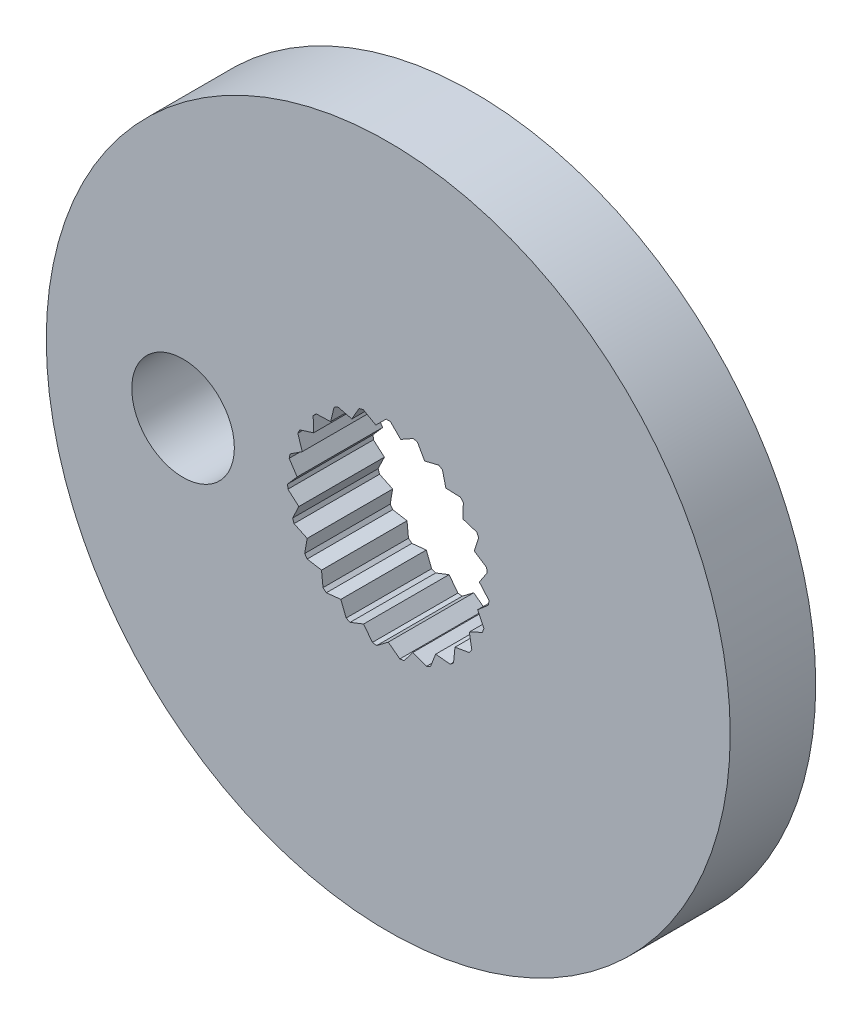
from build123d import *

# Parameters (mm, degrees)
SKETCH1_R              = 10
BOSS_EXTRUDE1_DEPTH    = 2.5
CUT_EXTRUDE1_OUTLINE_R = 1.5
CUT_EXTRUDE1_DEPTH     = 2.5


# Read off the part's stored shape, not the designer's step: Cut-Extrude1
with BuildPart() as part:
    # Sketch1 → Boss-Extrude1 (new body)
    with BuildSketch(Plane.XY):
        Circle(SKETCH1_R)
        Polygon((-2.644215925, 1.298692578), (-2.51581008, 0.894119117), (-2.870737377, 0.661322297), (-2.883640833, 0.599227456), (-2.896544289, 0.537132615), (-2.663747469, 0.182205319), (-2.942705268, -0.137717003), (-2.938377242, -0.20099051), (-2.934049215, -0.264264016), (-2.614126893, -0.543221815), (-2.796426171, -0.926542463), (-2.775187652, -0.986301929), (-2.753949133, -1.046061394), (-2.370628485, -1.228360672), (-2.442748938, -1.646650507), (-2.40617509, -1.698463845), (-2.369601242, -1.750277184), (-1.951311407, -1.822397637), (-1.907904191, -2.244634016), (-1.858707529, -2.284658469), (-1.809510867, -2.324682922), (-1.387274489, -2.281275706), (-1.231558919, -2.676143288), (-1.173388134, -2.701410425), (-1.115217349, -2.726677563), (-0.720349768, -2.570961993), (-0.463874555, -2.909175255), (-0.401043909, -2.917811129), (-0.338213262, -2.926447002), (0, -2.669971789), (0.338213262, -2.926447002), (0.401043909, -2.917811129), (0.463874555, -2.909175255), (0.720349768, -2.570961993), (1.115217349, -2.726677563), (1.173388134, -2.701410425), (1.231558919, -2.676143288), (1.387274489, -2.281275706), (1.809510867, -2.324682922), (1.858707529, -2.284658469), (1.907904191, -2.244634016), (1.951311407, -1.822397637), (2.369601242, -1.750277184), (2.40617509, -1.698463845), (2.442748938, -1.646650507), (2.370628485, -1.228360672), (2.753949133, -1.046061394), (2.775187652, -0.986301929), (2.796426171, -0.926542463), (2.614126893, -0.543221815), (2.934049215, -0.264264016), (2.938377242, -0.20099051), (2.942705268, -0.137717003), (2.663747469, 0.182205319), (2.896544289, 0.537132615), (2.883640833, 0.599227456), (2.870737377, 0.661322297), (2.51581008, 0.894119117), (2.644215925, 1.298692578), (2.615037976, 1.355003462), (2.585860027, 1.411314347), (2.181286567, 1.539720192), (2.195778161, 1.963934453), (2.152489715, 2.010285061), (2.109201269, 2.056635669), (1.684987008, 2.071127263), (1.584489576, 2.483520294), (1.530301139, 2.516473013), (1.476112702, 2.549425731), (1.063719671, 2.4489283), (0.855686648, 2.818914796), (0.794617128, 2.836025673), (0.733547608, 2.85313655), (0.363561112, 2.645103528), (0.063421356, 2.945243283), (0, 2.945243283), (-0.063421356, 2.945243283), (-0.363561112, 2.645103528), (-0.733547608, 2.85313655), (-0.794617128, 2.836025673), (-0.855686648, 2.818914796), (-1.063719671, 2.4489283), (-1.476112702, 2.549425731), (-1.530301139, 2.516473013), (-1.584489576, 2.483520294), (-1.684987008, 2.071127263), (-2.109201269, 2.056635669), (-2.152489715, 2.010285061), (-2.195778161, 1.963934453), (-2.181286567, 1.539720192), (-2.585860027, 1.411314347), (-2.615037976, 1.355003462), align=None, mode=Mode.SUBTRACT)
    extrude(amount=BOSS_EXTRUDE1_DEPTH)

    # Cut-Extrude1 outline → Cut-Extrude1 (cut)
    with BuildSketch(Plane.XY):
        with Locations((-6, 0)):
            Circle(CUT_EXTRUDE1_OUTLINE_R)
    extrude(amount=CUT_EXTRUDE1_DEPTH, mode=Mode.SUBTRACT)


solid = part.part
